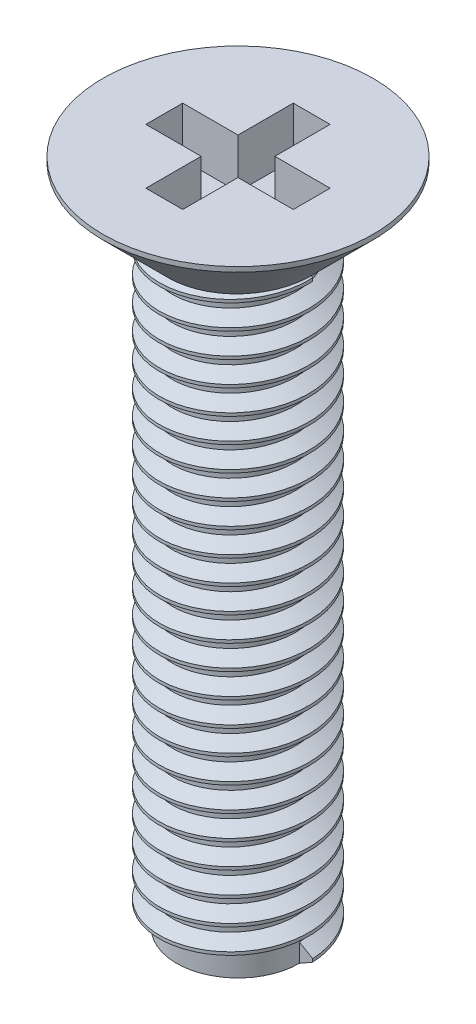
from build123d import *

# Parameters (mm, degrees)
SKETCH1_R           = 1.25
BOSS_EXTRUDE1_DEPTH = 12
SKETCH2_R           = 2.75
BOSS_EXTRUDE2_DEPTH = 1.6
CHAMFER2_SIZE       = 1.5
THREAD1_PITCH       = 0.5
SKETCH6_W           = 0.75
SKETCH6_H           = 1.125
SKETCH6_H_2         = 0.75
SKETCH6_W_2         = 1.125
CUT_EXTRUDE1_DEPTH  = 1


with BuildPart() as part:
    # Sketch1 → Boss-Extrude1 (new body)
    with BuildSketch(Plane(origin=(0, 0, 0), x_dir=(1, 0, 0), z_dir=(0, 1, 0))):
        with Locations(Location((0, 0, 0), (0, 0, 270))):
            Circle(SKETCH1_R)
    extrude(amount=-BOSS_EXTRUDE1_DEPTH)

    # Sketch2 → Boss-Extrude2 (add)
    with BuildSketch(Plane(origin=(0, 0, 0), x_dir=(1, 0, 0), z_dir=(0, 1, 0))):
        with Locations(Location((0, 0, 0), (0, 0, 270))):
            Circle(SKETCH2_R)
    extrude(amount=BOSS_EXTRUDE2_DEPTH)

    # Chamfer2
    chamfer2_edges = [part.edges().sort_by_distance(p)[0] for p in [
        (0, 0, -2.75),
    ]]
    chamfer(chamfer2_edges, length=CHAMFER2_SIZE - 0.0001)  # a hair under: the kernel refuses the full size

    # Thread1: the profile of Thread Profile1 profile screwed along a right-hand helix of 24 turns, 6 arcs to a turn; built about Z, then put on its axis
    thread1_z = Axis((0, 0, 0), (0, 0, 1))
    thread1_corners = [(1.2497, 0, -0.000173205), (1.520632938, 0, 0.156249999), (1.520632937, 0, 0.218749999), (1.2497, 0, 0.375173204)]
    with BuildLine(mode=Mode.PRIVATE) as thread1_profile:
        Line(thread1_corners[0], thread1_corners[1])
        Line(thread1_corners[1], thread1_corners[2])
        Line(thread1_corners[2], thread1_corners[3])
        Line(thread1_corners[3], thread1_corners[0])
    thread1_cap = Face(thread1_profile.wire())
    thread1_turn_angles = [0, 30, 60, 90, 120, 150, 180, 210, 240, 270, 300, 330, 360]
    thread1_turn_weights = [1, 0.8660254037844387, 1, 0.8660254037844387, 1, 0.8660254037844387, 1, 0.8660254037844387, 1, 0.8660254037844387, 1, 0.8660254037844387, 1]
    thread1_turn_rails = [Edge.make_bspline([Vector(p[0], p[1], 0).rotate(thread1_z, thread1_turn_angles[k]) / thread1_turn_weights[k] + Vector(0, 0, p[2] + THREAD1_PITCH * thread1_turn_angles[k] / 360) for k in range(13)], [0, 0, 0, 1, 1, 2, 2, 3, 3, 4, 4, 5, 5, 6, 6, 6], 2, thread1_turn_weights) for p in thread1_corners]
    thread1_turn_sides = [Face.make_surface_from_curves(thread1_turn_rails[p[0]], thread1_turn_rails[p[1]]) for p in [(0, 1), (1, 2), (2, 3), (3, 0)]]
    thread1 = Plane(origin=(0, -12, 0), x_dir=(1, 0, 0), z_dir=(0, 1, 0)) * Solid(Shell([*[p.moved(Location((0, 0, THREAD1_PITCH * i))) for i in range(24) for p in thread1_turn_sides], thread1_cap, thread1_cap.rotate(thread1_z, 8640).moved(Location((0, 0, THREAD1_PITCH * 8640 / 360)))]))
    add(thread1)

    # Sketch6 → Cut-Extrude1 (cut)
    with BuildSketch(Plane(origin=(0, 1.6, 0), x_dir=(1, 0, 0), z_dir=(0, 1, 0))):
        with Locations((0, 0.9375)):
            Rectangle(SKETCH6_W, SKETCH6_H)
        Rectangle(SKETCH6_W, SKETCH6_H_2)
        with Locations((0.9375, 0)):
            Rectangle(SKETCH6_W_2, SKETCH6_H_2)
        with Locations((0, -0.9375)):
            Rectangle(SKETCH6_W, SKETCH6_H)
        with Locations((-0.9375, 0)):
            Rectangle(SKETCH6_W_2, SKETCH6_H_2)
    extrude(amount=-CUT_EXTRUDE1_DEPTH, mode=Mode.SUBTRACT)


solid = part.part
